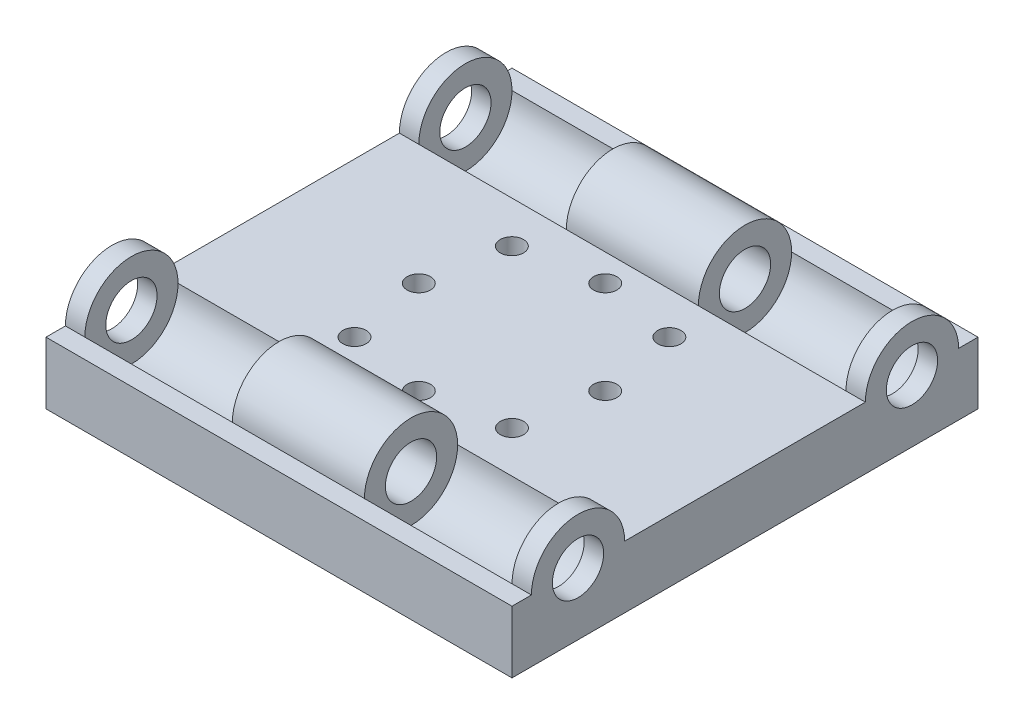
from build123d import *
from OCP.BRepFilletAPI import BRepFilletAPI_MakeChamfer

# Parameters (mm, degrees)
SKETCH_11_R         = 3.3
EXTRUDE_4_DEPTH     = 60
SKETCH_17_R         = 6
CUT_EXTRUDE_3_DEPTH = 19
SKETCH_18_R         = 6
CUT_EXTRUDE_4_DEPTH = 19
CUT_EXTRUDE_START   = -19
SKETCH_19_R         = 6
CUT_EXTRUDE_5_DEPTH = 19
SKETCH_21_R         = 6
CUT_EXTRUDE_6_DEPTH = 19
SKETCH_22_R         = 1.5
CUT_EXTRUDE_7_DEPTH = 100
SKETCH_28_R         = 3
EXTRUDE_5_DEPTH     = 1.5
CHAMFER_1_SIZE      = 1.5
CHAMFER_1_SIZE_2    = 0.5
SKETCH_29_R         = 1.5
CUT_EXTRUDE_9_DEPTH = 72.986055326


with BuildPart() as part:
    # 草图11 → 凸台-拉伸4 (new body)
    with BuildSketch(Plane(origin=(0, 0, 0), x_dir=(0, 0, -1), z_dir=(1, 0, 0))):
        with BuildLine():
            Line((-22.771084337, -3.256454389), (-22.771084337, -11.256454389))
            Line((-22.771084337, -11.256454389), (37.228915663, -11.256454389))
            Line((37.228915663, -11.256454389), (37.228915663, -3.256454389))
            Line((37.228915663, -3.256454389), (34.728915663, -3.256454389))
            ThreePointArc((34.728915663, -3.256454389), (28.728915663, 2.743545611), (22.728915663, -3.256454389))
            Line((22.728915663, -3.256454389), (-8.271084337, -3.256454389))
            ThreePointArc((-8.271084337, -3.256454389), (-14.271084337, 2.743545611), (-20.271084337, -3.256454389))
            Line((-20.271084337, -3.256454389), (-22.771084337, -3.256454389))
        make_face()
        with Locations((-14.271084337, -3.256454389)):
            Circle(SKETCH_11_R, mode=Mode.SUBTRACT)
        with Locations((28.728915663, -3.256454389)):
            Circle(SKETCH_11_R, mode=Mode.SUBTRACT)
    extrude(amount=-EXTRUDE_4_DEPTH)

    # 草图17 → 切除-拉伸3 (cut)
    with BuildSketch(Plane(origin=(-2.5, 0, 0), x_dir=(0, 0, -1), z_dir=(1, 0, 0))):
        with Locations((-14.271084337, -3.256454389)):
            Circle(SKETCH_17_R)
    extrude(amount=-CUT_EXTRUDE_3_DEPTH, mode=Mode.SUBTRACT)

    # 草图18 → 切除-拉伸4 (cut)
    with BuildSketch(Plane(origin=(-2.5, 0, 0), x_dir=(0, 0, -1), z_dir=(1, 0, 0))):
        with Locations((28.728915663, -3.256454389)):
            Circle(SKETCH_18_R)
    extrude(amount=-CUT_EXTRUDE_4_DEPTH, mode=Mode.SUBTRACT)

    # 草图19 → 切除-拉伸5 (cut)
    with BuildSketch(Plane.ZY.offset(57.5).offset(CUT_EXTRUDE_START)):
        with Locations((-28.728915663, -3.256454389)):
            Circle(SKETCH_19_R)
    extrude(amount=CUT_EXTRUDE_5_DEPTH, mode=Mode.SUBTRACT)

    # 草图21 → 切除-拉伸6 (cut)
    with BuildSketch(Plane.ZY.offset(57.5).offset(CUT_EXTRUDE_START)):
        with Locations((14.271084337, -3.256454389)):
            Circle(SKETCH_21_R)
    extrude(amount=CUT_EXTRUDE_6_DEPTH, mode=Mode.SUBTRACT)

    # 草图22 → 切除-拉伸7 (cut)
    with BuildSketch(Plane(origin=(0, -3.256454389, 0), x_dir=(1, 0, 0), z_dir=(0, 1, 0))):
        with Locations(Location((-30, 19.228915663, 0), (0, 0, 270))):
            Circle(SKETCH_22_R)
        with Locations(Location((-30, -4.771084337, 0), (0, 0, 270))):
            Circle(SKETCH_22_R)
        with Locations(Location((-18, 7.228915663, 0), (0, 0, 270))):
            Circle(SKETCH_22_R)
        with Locations(Location((-42, 7.228915663, 0), (0, 0, 270))):
            Circle(SKETCH_22_R)
        with Locations(Location((-19.87, 17.358915663, 0), (0, 0, 270))):
            Circle(SKETCH_22_R)
        with Locations(Location((-19.87, -2.901084337, 0), (0, 0, 270))):
            Circle(SKETCH_22_R)
        with Locations(Location((-40.15, -2.901084337, 0), (0, 0, 270))):
            Circle(SKETCH_22_R)
        with Locations(Location((-40.15, 17.358915663, 0), (0, 0, 270))):
            Circle(SKETCH_22_R)
    extrude(amount=-CUT_EXTRUDE_7_DEPTH, mode=Mode.SUBTRACT)

    # 草图28 → 凸台-拉伸5 (add)
    with BuildSketch(Plane.XZ.offset(11.256454389)):
        with Locations(Location((-19.87, 2.901084337, 0), (0, 0, 270))):
            Circle(SKETCH_28_R)
        with Locations(Location((-19.87, -17.358915663, 0), (0, 0, 270))):
            Circle(SKETCH_28_R)
        with Locations(Location((-40.15, -17.358915663, 0), (0, 0, 270))):
            Circle(SKETCH_28_R)
        with Locations(Location((-40.15, 2.901084337, 0), (0, 0, 270))):
            Circle(SKETCH_28_R)
    extrude(amount=EXTRUDE_5_DEPTH)

    # 倒角1
    chamfer_1_edges_1 = [part.edges().sort_by_distance(p)[0] for p in [
        (-19.87, -12.756454389, 5.901084337),
    ]]
    chamfer_1_side_1 = [part.faces().sort_by_distance(p)[0] for p in [
        (-19.87, -12.746454389, 5.901084337),
    ]]
    chamfer_1_edges_2 = [part.edges().sort_by_distance(p)[0] for p in [
        (-19.87, -12.756454389, -14.358915663),
    ]]
    chamfer_1_side_2 = [part.faces().sort_by_distance(p)[0] for p in [
        (-19.87, -12.746454389, -14.358915663),
    ]]
    chamfer_1_edges_3 = [part.edges().sort_by_distance(p)[0] for p in [
        (-40.15, -12.756454389, -14.358915663),
    ]]
    chamfer_1_side_3 = [part.faces().sort_by_distance(p)[0] for p in [
        (-40.15, -12.746454389, -14.358915663),
    ]]
    chamfer_1_edges_4 = [part.edges().sort_by_distance(p)[0] for p in [
        (-40.15, -12.756454389, 5.901084337),
    ]]
    chamfer_1_side_4 = [part.faces().sort_by_distance(p)[0] for p in [
        (-40.15, -12.746454389, 5.901084337),
    ]]
    chamfer_1 = BRepFilletAPI_MakeChamfer(part.part.solid().wrapped)
    for e in chamfer_1_edges_1:
        chamfer_1.Add(CHAMFER_1_SIZE - 0.0001, CHAMFER_1_SIZE_2 - 0.0001, e.wrapped, chamfer_1_side_1[0].wrapped)
    for e in chamfer_1_edges_2:
        chamfer_1.Add(CHAMFER_1_SIZE - 0.0001, CHAMFER_1_SIZE_2 - 0.0001, e.wrapped, chamfer_1_side_2[0].wrapped)
    for e in chamfer_1_edges_3:
        chamfer_1.Add(CHAMFER_1_SIZE - 0.0001, CHAMFER_1_SIZE_2 - 0.0001, e.wrapped, chamfer_1_side_3[0].wrapped)
    for e in chamfer_1_edges_4:
        chamfer_1.Add(CHAMFER_1_SIZE - 0.0001, CHAMFER_1_SIZE_2 - 0.0001, e.wrapped, chamfer_1_side_4[0].wrapped)
    add(Compound.cast(chamfer_1.Shape()), mode=Mode.REPLACE)  # a hair under: the kernel refuses the full size

    # 草图29 → 切除-拉伸9 (cut, through all)
    with BuildSketch(Plane(origin=(0, -11.256454389, 0), x_dir=(1, 0, 0), z_dir=(0, 1, 0))):
        with Locations(Location((-40.15, -2.901084337, 0), (0, 0, 270))):
            Circle(SKETCH_29_R)
        with Locations(Location((-40.15, 17.358915663, 0), (0, 0, 270))):
            Circle(SKETCH_29_R)
        with Locations(Location((-19.87, 17.358915663, 0), (0, 0, 270))):
            Circle(SKETCH_29_R)
        with Locations(Location((-19.87, -2.901084337, 0), (0, 0, 270))):
            Circle(SKETCH_29_R)
    extrude(amount=-CUT_EXTRUDE_9_DEPTH, mode=Mode.SUBTRACT)


solid = part.part
